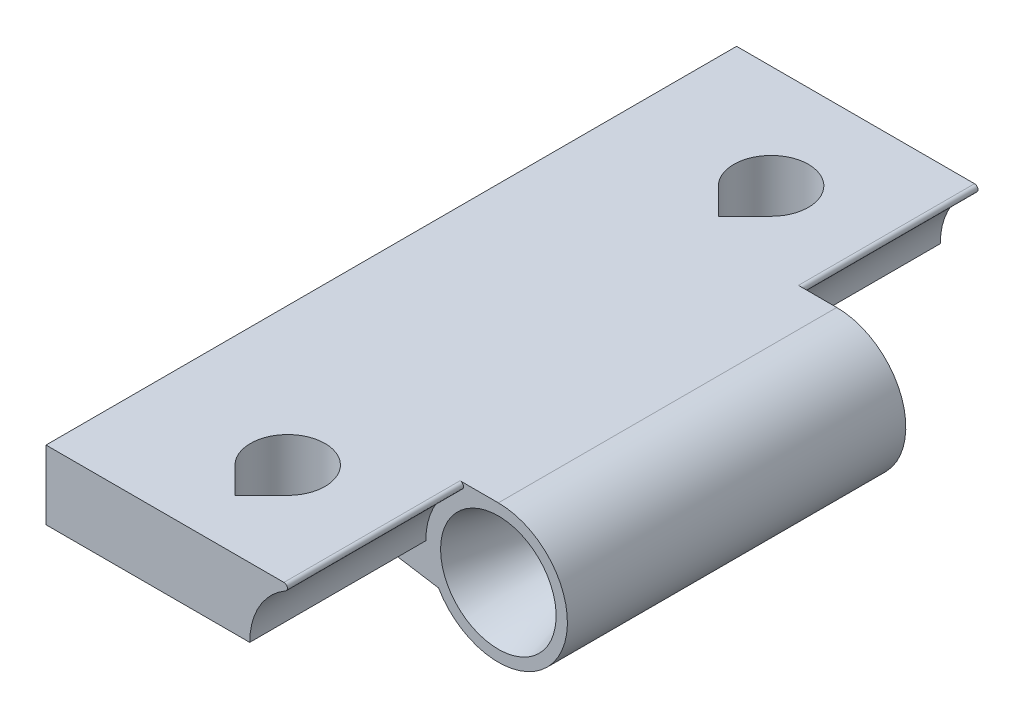
from build123d import *

# Parameters (mm, degrees)
BOSS_EXTRUDE1_DEPTH = 12.75
BOSS_EXTRUDE2_DEPTH = 24.5
BOSS_EXTRUDE3_DEPTH = 12.75
CUT_EXTRUDE1_DEPTH  = 34.54101984
CUT_EXTRUDE2_DEPTH  = 34.54101984
FILLET2_R           = 0.25


with BuildPart() as part:
    # Sketch1 → Boss-Extrude1 (new body)
    with BuildSketch(Plane(origin=(0, 0, -25), x_dir=(-1, 0, 0), z_dir=(0, 0, -1))):
        with BuildLine():
            Line((5.250000075, 0), (20.000000298, 0))
            Line((20.000000298, 0), (20.000000298, 5))
            Line((20.000000298, 5), (2.772634274, 5))
            ThreePointArc((2.772634274, 5), (2.53130745, 4.815279124), (2.646605445, 4.534090912))
            ThreePointArc((2.646605445, 4.534090912), (4.552866107, 2.614175013), (5.250000075, 0))
        make_face()
    extrude(amount=-BOSS_EXTRUDE1_DEPTH)

    # Sketch2 → Boss-Extrude2 (add)
    with BuildSketch(Plane.XY.offset(-12.25)):
        with BuildLine():
            Line((-20.000000298, 5), (0, 5))
            ThreePointArc((0, 5), (4.330127019, -2.5), (-4.330127019, -2.5))
            Line((-4.330127019, -2.5), (-20.000000298, 0))
            Line((-20.000000298, 0), (-20.000000298, 5))
        make_face()
    extrude(amount=BOSS_EXTRUDE2_DEPTH)

    # Sketch3 → Boss-Extrude3 (add)
    with BuildSketch(Plane.XY.offset(12.25)):
        with BuildLine():
            Line((-20.000000298, 5), (-2.772634274, 5))
            ThreePointArc((-2.772634274, 5), (-2.53130745, 4.815279124), (-2.646605445, 4.534090912))
            ThreePointArc((-2.646605445, 4.534090912), (-4.552866107, 2.614175013), (-5.250000075, 0))
            Line((-5.250000075, 0), (-20.000000298, 0))
            Line((-20.000000298, 0), (-20.000000298, 5))
        make_face()
    extrude(amount=BOSS_EXTRUDE3_DEPTH)

    # Sketch4 → Cut-Extrude1 (cut, through all)
    with BuildSketch(Plane(origin=(0, 5, 0), x_dir=(-1, 0, 0), z_dir=(0, 1, 0))):
        with BuildLine():
            Line((10, -13.681623382), (8.090811691, -15.590811691))
            ThreePointArc((8.090811691, -15.590811691), (10, -20.2), (11.909188309, -15.590811691))
            Line((11.909188309, -15.590811691), (10, -13.681623382))
        make_face()
    extrude(amount=-CUT_EXTRUDE1_DEPTH, mode=Mode.SUBTRACT)

    # Sketch5 → Cut-Extrude2 (cut, through all)
    with BuildSketch(Plane(origin=(0, 5, 0), x_dir=(-1, 0, 0), z_dir=(0, 1, 0))):
        with BuildLine():
            Line((10, 21.318376618), (8.090811691, 19.409188309))
            ThreePointArc((8.090811691, 19.409188309), (10, 14.8), (11.909188309, 19.409188309))
            Line((11.909188309, 19.409188309), (10, 21.318376618))
        make_face()
    extrude(amount=-CUT_EXTRUDE2_DEPTH, mode=Mode.SUBTRACT)

    # Sketch6 → Cut-Revolve1 (revolve, cut)
    with BuildSketch(Plane.XZ):
        with BuildLine():
            Line((4.182916362, 12.25), (0, 12.25))
            Line((0, 12.25), (0, -12.25))
            Line((0, -12.25), (4.182916362, -12.25))
            ThreePointArc((4.182916362, -12.25), (2.298735161, 0), (4.182916362, 12.25))
        make_face()
    revolve(axis=Axis((0, 0, 12.25), (0, 0, -1)), mode=Mode.SUBTRACT)

    # Fillet2
    fillet2_edges = [part.edges().sort_by_distance(p)[0] for p in [
        (-20.000000298, 0, -18.625),
    ]]
    fillet(fillet2_edges, radius=FILLET2_R)


solid = part.part
